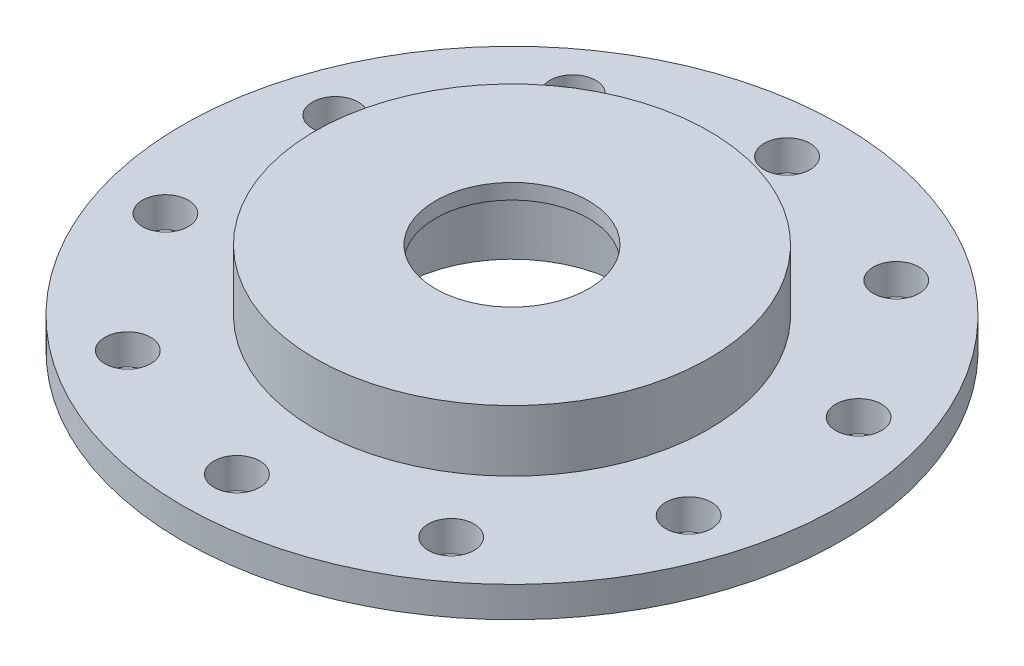
from build123d import *

# Parameters (mm, degrees)
SKETCH2_R           = 107.826846
SKETCH2_R_2         = 7.5
BOSS_EXTRUDE1_DEPTH = 10
SKETCH3_R           = 71.687
SKETCH3_R_2         = 64.447846
CUT_EXTRUDE1_DEPTH  = 3
SKETCH4_W           = 3
SKETCH4_H           = 5
CUT_EXTRUDE2_DEPTH  = 153.817726186
CIRPATTERN1_COUNT   = 35
SKETCH5_R           = 47.826846
CUT_EXTRUDE3_DEPTH  = 153.817726186
SKETCH6_R           = 64.447846
SKETCH6_R_2         = 47.826846
BOSS_EXTRUDE3_DEPTH = 10
SKETCH8_W           = 3
SKETCH8_H           = 5
CUT_EXTRUDE4_DEPTH  = 154.796155468
CIRPATTERN7_COUNT   = 35
SKETCH9_R           = 64.447846
SKETCH9_R_2         = 57.826846
BOSS_EXTRUDE4_DEPTH = 5
SKETCH10_R          = 64.447846
SKETCH10_R_2        = 25
BOSS_EXTRUDE5_DEPTH = 5
BOSS_EXTRUDE7_START = 10
SKETCH11_R          = 47.826846
SKETCH11_R_2        = 36.6524
BOSS_EXTRUDE7_DEPTH = 10
SKETCH12_R          = 47.826846
SKETCH12_R_2        = 36.6524
BOSS_EXTRUDE8_DEPTH = 10


with BuildPart() as part:
    # Sketch2 → Boss-Extrude1 (new body)
    with BuildSketch(Plane(origin=(0, 0, 0), x_dir=(1, 0, 0), z_dir=(0, 1, 0))):
        Circle(SKETCH2_R)
        with Locations((0, 90)):
            Circle(SKETCH2_R_2, mode=Mode.SUBTRACT)
        with Locations((52.900672706, 72.811529494)):
            Circle(SKETCH2_R_2, mode=Mode.SUBTRACT)
        with Locations((85.595086467, 27.811529494)):
            Circle(SKETCH2_R_2, mode=Mode.SUBTRACT)
        with Locations((85.595086467, -27.811529494)):
            Circle(SKETCH2_R_2, mode=Mode.SUBTRACT)
        with Locations((52.900672706, -72.811529494)):
            Circle(SKETCH2_R_2, mode=Mode.SUBTRACT)
        with Locations((0, -90)):
            Circle(SKETCH2_R_2, mode=Mode.SUBTRACT)
        with Locations((-52.900672706, -72.811529494)):
            Circle(SKETCH2_R_2, mode=Mode.SUBTRACT)
        with Locations((-85.595086467, -27.811529494)):
            Circle(SKETCH2_R_2, mode=Mode.SUBTRACT)
        with Locations((-85.595086467, 27.811529494)):
            Circle(SKETCH2_R_2, mode=Mode.SUBTRACT)
        with Locations((-52.900672706, 72.811529494)):
            Circle(SKETCH2_R_2, mode=Mode.SUBTRACT)
    extrude(amount=BOSS_EXTRUDE1_DEPTH)

    # Sketch3 → Cut-Extrude1 (cut)
    with BuildSketch(Plane.XZ):
        Circle(SKETCH3_R)
        Circle(SKETCH3_R_2, mode=Mode.SUBTRACT)
    extrude(amount=-CUT_EXTRUDE1_DEPTH, mode=Mode.SUBTRACT)

    # Sketch4 → Cut-Extrude2 (cut, through all)
    with BuildSketch(Plane(origin=(0, 10, 0), x_dir=(1, 0, 0), z_dir=(0, 1, 0))):
        with Locations((0, 55.326846)):
            Rectangle(SKETCH4_W, SKETCH4_H)
    cut_extrude2 = extrude(amount=-CUT_EXTRUDE2_DEPTH, mode=Mode.SUBTRACT)

    # CirPattern1: Cut-Extrude2 ×35 about axis
    cirpattern1_axis = Axis((0, 10, 0), (0, 1, 0))
    for i in range(1, CIRPATTERN1_COUNT):
        add(cut_extrude2.rotate(cirpattern1_axis, i * 360 / CIRPATTERN1_COUNT), mode=Mode.SUBTRACT)

    # Sketch5 → Cut-Extrude3 (cut, through all)
    with BuildSketch(Plane(origin=(0, 10, 0), x_dir=(1, 0, 0), z_dir=(0, 1, 0))):
        Circle(SKETCH5_R)
    extrude(amount=-CUT_EXTRUDE3_DEPTH, mode=Mode.SUBTRACT)



with BuildPart() as body_2:
    # Sketch6 → Boss-Extrude3 (new body)
    with BuildSketch(Plane(origin=(0, 10, 0), x_dir=(1, 0, 0), z_dir=(0, 1, 0))):
        Circle(SKETCH6_R)
        Circle(SKETCH6_R_2, mode=Mode.SUBTRACT)
    extrude(amount=BOSS_EXTRUDE3_DEPTH)

    # Sketch8 → Cut-Extrude4 (cut, through all)
    with BuildSketch(Plane(origin=(0, 20, 0), x_dir=(1, 0, 0), z_dir=(0, 1, 0))):
        with Locations((0, 55.326846)):
            Rectangle(SKETCH8_W, SKETCH8_H)
    cut_extrude4 = extrude(amount=-CUT_EXTRUDE4_DEPTH, mode=Mode.SUBTRACT)

    # CirPattern7: Cut-Extrude4 ×35 about axis
    cirpattern7_axis = Axis((0, 20, 0), (0, 1, 0))
    for i in range(1, CIRPATTERN7_COUNT):
        add(cut_extrude4.rotate(cirpattern7_axis, i * 360 / CIRPATTERN7_COUNT), mode=Mode.SUBTRACT)

    # Sketch9 → Boss-Extrude4 (add)
    with BuildSketch(Plane(origin=(0, 20, 0), x_dir=(1, 0, 0), z_dir=(0, 1, 0))):
        Circle(SKETCH9_R)
        Circle(SKETCH9_R_2, mode=Mode.SUBTRACT)
    extrude(amount=BOSS_EXTRUDE4_DEPTH)

    # Sketch10 → Boss-Extrude5 (add)
    with BuildSketch(Plane(origin=(0, 25, 0), x_dir=(1, 0, 0), z_dir=(0, 1, 0))):
        Circle(SKETCH10_R)
        Circle(SKETCH10_R_2, mode=Mode.SUBTRACT)
    extrude(amount=BOSS_EXTRUDE5_DEPTH)


with BuildPart() as part_1:
    add(part.part)

    add(body_2.part)  # Boss-Extrude7 merges body 2
    # Sketch11 → Boss-Extrude7 (add)
    with BuildSketch(Plane(origin=(0, 10, 0), x_dir=(1, 0, 0), z_dir=(0, 1, 0)).offset(BOSS_EXTRUDE7_START)):
        Circle(SKETCH11_R)
        Circle(SKETCH11_R_2, mode=Mode.SUBTRACT)
    extrude(amount=-BOSS_EXTRUDE7_DEPTH)

    # Sketch12 → Boss-Extrude8 (add)
    with BuildSketch(Plane.XZ.offset(-10)):
        Circle(SKETCH12_R)
        Circle(SKETCH12_R_2, mode=Mode.SUBTRACT)
    extrude(amount=BOSS_EXTRUDE8_DEPTH)


solid = part_1.part
